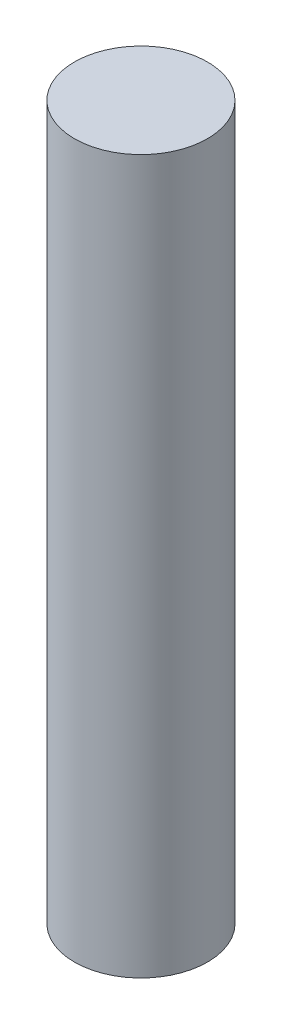
from build123d import *

# Parameters (mm, degrees)
SKETCH1_R           = 3.175
BOSS_EXTRUDE1_DEPTH = 34.036


with BuildPart() as part:
    # Sketch1 → Boss-Extrude1 (new body)
    with BuildSketch(Plane(origin=(0, 0, 0), x_dir=(1, 0, 0), z_dir=(0, 1, 0))):
        Circle(SKETCH1_R)
    extrude(amount=BOSS_EXTRUDE1_DEPTH)


solid = part.part
